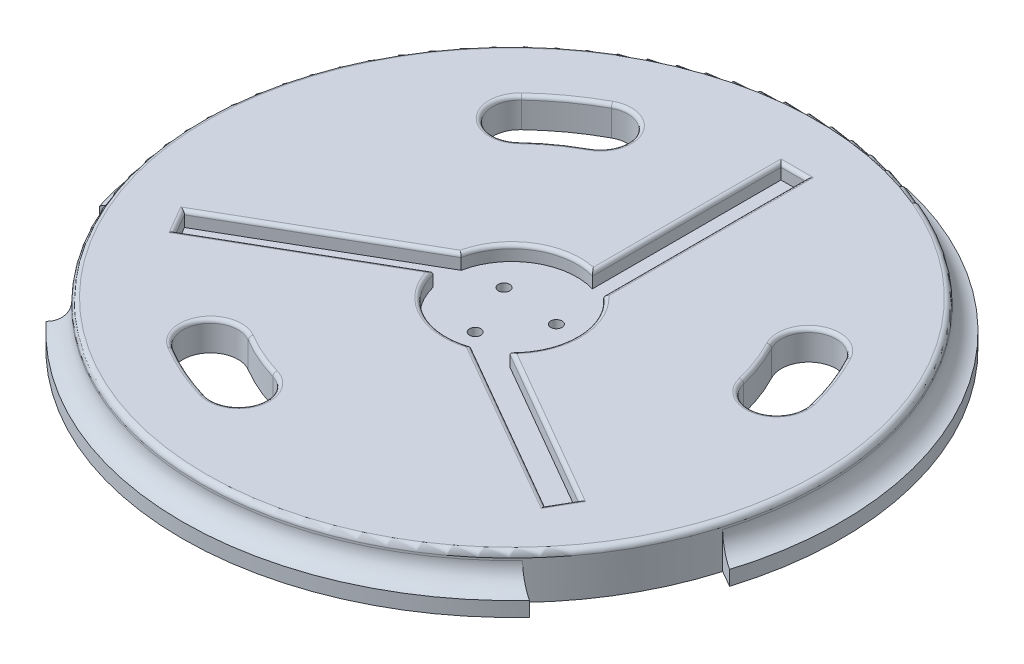
from build123d import *
from build123d.topology import SkipClean

# Parameters (mm, degrees)
CROQUIS2_R              = 85
SALIENTE_EXTRUIR1_DEPTH = 4
SALIENTE_EXTRUIR2_START = -4
CROQUIS3_R              = 85
SALIENTE_EXTRUIR2_DEPTH = 4
CROQUIS4_R              = 1.55
CORTAR_EXTRUIR2_DEPTH   = 4
CROQUIS5_R              = 90
CROQUIS5_R_2            = 80
SALIENTE_EXTRUIR3_DEPTH = 4
REDONDEO1_R             = 20
CORTAR_EXTRUIR3_DEPTH   = 14
CORTAR_EXTRUIR4_DEPTH   = 14
REDONDEO2_R             = 6
REDONDEO3_R             = 1.5
REDONDEO5_R             = 1


with BuildPart() as part:
    # Croquis2 → Saliente-Extruir1 (new body)
    with BuildSketch(Plane(origin=(0, 0, 0), x_dir=(1, 0, 0), z_dir=(0, 1, 0))):
        with Locations(Location((0, 0, 0), (0, 0, 270))):
            Circle(CROQUIS2_R)
        with BuildLine():
            Line((-65.276202, -24.124776), (-17.397927, 3.517759))
            ThreePointArc((-17.397927, 3.517759), (-9.203419, 15.177601), (4.92398, 17.053355))
            Line((4.92398, 17.053355), (4.92398, 68.55))
            Line((4.92398, 68.55), (11.77398, 68.55))
            Line((11.77398, 68.55), (11.77398, 13.282917))
            ThreePointArc((11.77398, 13.282917), (17.746297, 0.362543), (12.306649, -12.790969))
            Line((12.306649, -12.790969), (56.904051, -38.539292))
            Line((56.904051, -38.539292), (53.479051, -44.471566))
            Line((53.479051, -44.471566), (5.616354, -16.838024))
            ThreePointArc((5.616354, -16.838024), (-8.546162, -15.557172), (-17.223471, -4.291217))
            Line((-17.223471, -4.291217), (-61.851202, -30.05705))
            Line((-61.851202, -30.05705), (-65.276202, -24.124776))
        make_face(mode=Mode.SUBTRACT)
    extrude(amount=SALIENTE_EXTRUIR1_DEPTH)

    # Croquis3 → Saliente-Extruir2 (add)
    with BuildSketch(Plane(origin=(0, 0, 0), x_dir=(1, 0, 0), z_dir=(0, 1, 0)).offset(SALIENTE_EXTRUIR2_START)):
        with Locations(Location((0, 0, 0), (0, 0, 270))):
            Circle(CROQUIS3_R)
    extrude(amount=SALIENTE_EXTRUIR2_DEPTH)

    # Croquis4 → Cortar-Extruir2 (cut)
    with BuildSketch(Plane(origin=(0, 0, 0), x_dir=(1, 0, 0), z_dir=(0, 1, 0))):
        with Locations(Location((-7.451113, 5.305706, 0), (0, 0, 270))):
            Circle(CROQUIS4_R)
        with Locations(Location((8.34898, 3.8, 0), (0, 0, 270))):
            Circle(CROQUIS4_R)
        with Locations(Location((-0.883593, -9.130429, 0), (0, 0, 270))):
            Circle(CROQUIS4_R)
    extrude(amount=-CORTAR_EXTRUIR2_DEPTH, mode=Mode.SUBTRACT)

    # Croquis5 → Saliente-Extruir3 (add)
    with BuildSketch(Plane.XZ.offset(4)):
        with Locations(Location((0, 0, 0), (0, 0, 270))):
            Circle(CROQUIS5_R)
        with Locations(Location((0, 0, 0), (0, 0, 270))):
            Circle(CROQUIS5_R_2, mode=Mode.SUBTRACT)
    extrude(amount=SALIENTE_EXTRUIR3_DEPTH)

    # Redondeo1
    # the kernel refuses this fillet: 20 mm, written as the material it adds along each edge
    with BuildSketch(Plane(origin=(0, -4, 0), x_dir=(0, 0, -1), z_dir=(-1, 0, 0))) as redondeo1_piece_1:
        with BuildLine():
            CenterArc((68, 20), REDONDEO1_R, 270, 36.869898)
            Line((68, 0), (68, -0.4))
            Line((68, -0.4), (80, -0.4))
            Line((80, -0.4), (80.4, 0))
            ThreePointArc((80.4, 0), (80.4, 2), (80.24, 3.68))
            Line((80.24, 3.68), (80, 4))
        make_face()
    revolve(axis=Axis((0, -4, 0), (0, -1, 0)))

    # Croquis6 → Cortar-Extruir3 (cut)
    with BuildSketch(Plane(origin=(0, 4, 0), x_dir=(1, 0, 0), z_dir=(0, 1, 0))):
        with BuildLine():
            ThreePointArc((65.644274, 15.718758), (63.172363, 23.780297), (59.714669, 31.470753))
            ThreePointArc((59.714669, 31.470753), (49.582956, 34.608966), (46.444743, 24.477252))
            ThreePointArc((46.444743, 24.477252), (49.13406, 18.495787), (51.056657, 12.2257))
            ThreePointArc((51.056657, 12.2257), (60.096994, 6.678421), (65.644274, 15.718758))
        make_face()
        with BuildLine():
            ThreePointArc((-34.621383, -57.944886), (-27.126992, -61.809193), (-19.209293, -64.708987))
            ThreePointArc((-19.209293, -64.708987), (-9.88504, -59.653466), (-14.940561, -50.329212))
            ThreePointArc((-14.940561, -50.329212), (-21.098771, -48.073817), (-26.927742, -45.068245))
            ThreePointArc((-26.927742, -45.068245), (-37.212883, -47.659745), (-34.621383, -57.944886))
        make_face()
        with BuildLine():
            ThreePointArc((-32.173142, 59.339185), (-39.643214, 54.632093), (-46.43498, 48.99023))
            ThreePointArc((-46.43498, 48.99023), (-46.718897, 38.387429), (-36.116096, 38.103512))
            ThreePointArc((-36.116096, 38.103512), (-30.833611, 42.491628), (-25.023555, 46.1527))
            ThreePointArc((-25.023555, 46.1527), (-22.005106, 56.320736), (-32.173142, 59.339185))
        make_face()
    extrude(amount=-CORTAR_EXTRUIR3_DEPTH, mode=Mode.SUBTRACT)

    # Croquis7 → Cortar-Extruir4 (cut)
    with SkipClean():  # the faces are left unmerged after this step: merging them gives an invalid solid
        with BuildSketch(Plane(origin=(0, 0, 0), x_dir=(1, 0, 0), z_dir=(0, 1, 0))):
            with BuildLine():
                ThreePointArc((20, 87.749644), (0, 90), (-20, 87.749644))
                Line((-20, 87.749644), (-20, 82.613558))
                ThreePointArc((-20, 82.613558), (0, 85), (20, 82.613558))
                Line((20, 82.613558), (20, 87.749644))
            make_face()
            with BuildLine():
                Line((-81.54544, -23.986271), (-85.993421, -26.554314))
                ThreePointArc((-85.993421, -26.554314), (-77.942286, -45), (-65.993421, -61.19533))
                Line((-65.993421, -61.19533), (-61.54544, -58.627287))
                ThreePointArc((-61.54544, -58.627287), (-73.612159, -42.5), (-81.54544, -23.986271))
            make_face()
            with BuildLine():
                Line((61.54544, -58.627287), (65.993421, -61.19533))
                ThreePointArc((65.993421, -61.19533), (77.942286, -45), (85.993421, -26.554314))
                Line((85.993421, -26.554314), (81.54544, -23.986271))
                ThreePointArc((81.54544, -23.986271), (73.612159, -42.5), (61.54544, -58.627287))
            make_face()
        extrude(amount=-CORTAR_EXTRUIR4_DEPTH, mode=Mode.SUBTRACT)

    # Redondeo2
    # the kernel refuses this fillet: 6 mm, written as the material it adds along each edge
    with BuildSketch(Plane(origin=(0, -4, 0), x_dir=(0, 0, 1), z_dir=(-1, 0, 0))) as redondeo2_piece_1_section:
        with BuildLine():
            CenterArc((91, 5.91608), REDONDEO2_R, 180, 80.405932)
            Line((85, 5.91608), (85, 0))
            Line((85, 0), (90, 0))
        make_face()
    redondeo2_piece_1 = revolve(axis=Axis((0, -4, 0), (0, 1, 0)), revolution_arc=56.361703, mode=Mode.PRIVATE)
    redondeo2_piece_1 = split(redondeo2_piece_1, bisect_by=Plane(origin=(50.216265, -1.96465, 52.086385), z_dir=(-0.5000000000000014, 0, 0.8660254037844379)), keep=Keep.TOP, mode=Mode.PRIVATE)
    add(redondeo2_piece_1)
    with BuildSketch(Plane(origin=(0, -4, 0), x_dir=(-0.06340198221663615, 0, -0.9979880703951332), z_dir=(0.9979880703951332, 0, -0.06340198221663615))) as redondeo2_piece_2_section:
        with BuildLine():
            CenterArc((91, 5.91608), REDONDEO2_R, 180, 80.405932)
            Line((85, 5.91608), (85, 0))
            Line((85, 0), (90, 0))
        make_face()
    redondeo2_piece_2 = revolve(axis=Axis((0, -4, 0), (0, 1, 0)), revolution_arc=112.729792, mode=Mode.PRIVATE)
    redondeo2_piece_2 = split(redondeo2_piece_2, bisect_by=Plane(origin=(-20, -1.96465, -43.20413), z_dir=(-1, 0, 0)), keep=Keep.TOP, mode=Mode.PRIVATE)
    redondeo2_piece_2 = split(redondeo2_piece_2, bisect_by=Plane(origin=(-47.415874, -1.96465, 4.281557), z_dir=(-0.5000000000000031, 0, -0.8660254037844368)), keep=Keep.TOP, mode=Mode.PRIVATE)
    add(redondeo2_piece_2)
    with BuildSketch(Plane(origin=(0, -4, 0), x_dir=(0.8959840127443035, 0, 0.4440863079476957), z_dir=(-0.4440863079476957, 0, 0.8959840127443035))) as redondeo2_piece_3_section:
        with BuildLine():
            CenterArc((91, 5.91608), REDONDEO2_R, 180, 80.405932)
            Line((85, 5.91608), (85, 0))
            Line((85, 0), (90, 0))
        make_face()
    redondeo2_piece_3 = revolve(axis=Axis((0, -4, 0), (0, 1, 0)), revolution_arc=112.729792, mode=Mode.PRIVATE)
    redondeo2_piece_3 = split(redondeo2_piece_3, bisect_by=Plane(origin=(20, -1.96465, -43.20413), z_dir=(1, 0, 0)), keep=Keep.TOP, mode=Mode.PRIVATE)
    redondeo2_piece_3 = split(redondeo2_piece_3, bisect_by=Plane(origin=(47.415874, -1.96465, 4.281557), z_dir=(0.5000000000000029, 0, -0.866025403784437)), keep=Keep.TOP, mode=Mode.PRIVATE)
    add(redondeo2_piece_3)
    with BuildSketch(Plane(origin=(0, -4, 0), x_dir=(-0.8325511658864714, 0, 0.553948152971988), z_dir=(-0.553948152971988, 0, -0.8325511658864714))) as redondeo2_piece_4_section:
        with BuildLine():
            CenterArc((91, 5.91608), REDONDEO2_R, 180, 80.405932)
            Line((85, 5.91608), (85, 0))
            Line((85, 0), (90, 0))
        make_face()
    redondeo2_piece_4 = revolve(axis=Axis((0, -4, 0), (0, 1, 0)), revolution_arc=56.361703, mode=Mode.PRIVATE)
    redondeo2_piece_4 = split(redondeo2_piece_4, bisect_by=Plane(origin=(-50.216265, -1.96465, 52.086385), z_dir=(0.5000000000000049, 0, 0.8660254037844358)), keep=Keep.TOP, mode=Mode.PRIVATE)
    add(redondeo2_piece_4)

    # Redondeo3
    redondeo3_edges = [part.edges().sort_by_distance(p)[0] for p in [
        (0, 4, -85),
    ]]
    fillet(redondeo3_edges, radius=REDONDEO3_R)

    # Redondeo5
    redondeo5_edges = [part.edges().sort_by_distance(p)[0] for p in [
        (-37.212883, 4, 47.659745),
        (-27.126992, 4, 61.809193),
        (-9.88504, 4, 59.653466),
        (-21.098771, 4, 48.073817),
        (-22.005106, 4, -56.320736),
        (-39.643214, 4, -54.632093),
        (-46.718897, 4, -38.387429),
        (-30.833611, 4, -42.491628),
        (-9.203419, 4, -15.177601),
        (-41.337065, 4, 10.303508),
        (-63.563702, 4, 27.090913),
        (-39.537337, 4, 17.174133),
        (-8.546162, 4, 15.557172),
        (29.547703, 4, 30.654795),
        (55.191551, 4, 41.505429),
        (34.60535, 4, 25.665131),
        (17.746297, 4, -0.362543),
        (11.77398, 4, -40.916459),
        (8.34898, 4, -68.55),
        (4.92398, 4, -42.801678),
        (60.096994, 4, -6.678421),
        (63.172363, 4, -23.780297),
        (49.582956, 4, -34.608966),
        (49.13406, 4, -18.495787),
    ]]
    fillet(redondeo5_edges, radius=REDONDEO5_R)


solid = part.part
